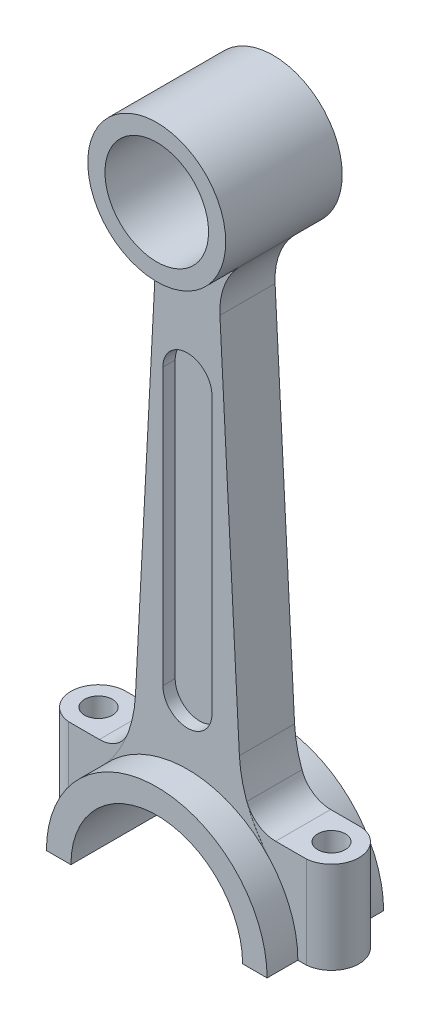
from build123d import *
from build123d.topology import SkipClean

# Parameters (mm, degrees)
SKETCH1_R           = 16.9
BOSS_EXTRUDE1_DEPTH = 9
SKETCH3_R           = 22.5
SKETCH3_R_2         = 16.9
BOSS_EXTRUDE2_DEPTH = 19
SKETCH4_R           = 4.5
BOSS_EXTRUDE3_DEPTH = 30
CUT_EXTRUDE2_DEPTH  = 4
CUT_EXTRUDE3_DEPTH  = 138.13719408
FILLET1_R           = 10
FILLET2_R           = 10
SKETCH7_R           = 4.523289267
SKETCH7_R_2         = 4.5
CUT_EXTRUDE4_DEPTH  = 230.372382819


with BuildPart() as part:
    # Sketch1 → Boss-Extrude1 (new, symmetric)
    with BuildSketch(Plane.XY):
        with BuildLine():
            Line((-10.60459099, 68.908072309), (-16.957576671, -52.314115855))
            ThreePointArc((-16.957576671, -52.314115855), (-19.883826234, -65.373191797), (-26.953938029, -76.736110444))
            ThreePointArc((-26.953938029, -76.736110444), (-33.66260365, -87.839548775), (-36, -100.6))
            Line((-36, -100.6), (-28, -100.6))
            ThreePointArc((-28, -100.6), (0, -72.6), (28, -100.6))
            Line((28, -100.6), (36, -100.6))
            ThreePointArc((36, -100.6), (33.66260365, -87.839548775), (26.953938029, -76.736110444))
            ThreePointArc((26.953938029, -76.736110444), (19.883826234, -65.373191797), (16.957576671, -52.314115855))
            Line((16.957576671, -52.314115855), (10.60459099, 68.908072309))
            ThreePointArc((10.60459099, 68.908072309), (11.910272087, 77.724804636), (16.536877761, 85.342815662))
            ThreePointArc((16.536877761, 85.342815662), (0, 123.1), (-16.536877761, 85.342815662))
            ThreePointArc((-16.536877761, 85.342815662), (-11.910272087, 77.724804636), (-10.60459099, 68.908072309))
        make_face()
        with Locations((0, 100.6)):
            Circle(SKETCH1_R, mode=Mode.SUBTRACT)
    extrude(amount=BOSS_EXTRUDE1_DEPTH, both=True)

    # Sketch3 → Boss-Extrude2 (add, symmetric)
    # profile 1 of 2: a face of its own
    with SkipClean():  # the faces are left unmerged after this step: merging them gives an invalid solid
        with BuildSketch(Plane.XY):
            with Locations((0, 100.6)):
                Circle(SKETCH3_R)
            with Locations((0, 100.6)):
                Circle(SKETCH3_R_2, mode=Mode.SUBTRACT)
        # profile 2 of 2: a face of its own
        with BuildSketch(Plane.XY):
            with BuildLine():
                Line((-28, -100.6), (-36, -100.6))
                ThreePointArc((-36, -100.6), (0, -64.6), (36, -100.6))
                Line((36, -100.6), (28, -100.6))
                ThreePointArc((28, -100.6), (0, -72.6), (-28, -100.6))
            make_face()
        extrude(amount=BOSS_EXTRUDE2_DEPTH, both=True)

    # Sketch4 → Boss-Extrude3 (add)
    with SkipClean():  # the faces are left unmerged after this step: merging them gives an invalid solid
        with BuildSketch(Plane.XZ.offset(100.6)):
            with BuildLine():
                Line((28, 8.968695557), (-28, 8.968695557))
                Line((-28, 8.968695557), (-38.75, 8.968695557))
                ThreePointArc((-38.75, 8.968695557), (-47, 0), (-38.75, -8.968695557))
                Line((-38.75, -8.968695557), (-28, -8.968695557))
                Line((-28, -8.968695557), (28, -8.968695557))
                Line((28, -8.968695557), (38.75, -8.968695557))
                ThreePointArc((38.75, -8.968695557), (47, 0), (38.75, 8.968695557))
                Line((38.75, 8.968695557), (28, 8.968695557))
            make_face()
            with Locations((-38, 0)):
                Circle(SKETCH4_R, mode=Mode.SUBTRACT)
            with Locations((38, 0)):
                Circle(SKETCH4_R, mode=Mode.SUBTRACT)
        extrude(amount=-BOSS_EXTRUDE3_DEPTH)

    # Sketch5 → Cut-Extrude2 (cut)
    with SkipClean():  # the faces are left unmerged after this step: merging them gives an invalid solid
        with BuildSketch(Plane.XY.offset(9)):
            with BuildLine():
                Line((-8, 45), (-8, -45))
                ThreePointArc((-8, -45), (0, -53), (8, -45))
                Line((8, -45), (8, 45))
                ThreePointArc((8, 45), (0, 53), (-8, 45))
            make_face()
        cut_extrude2 = extrude(amount=-CUT_EXTRUDE2_DEPTH, mode=Mode.SUBTRACT)

    # Mirror1: Cut-Extrude2 across plane
    with SkipClean():  # the faces are left unmerged after this step: merging them gives an invalid solid
        add(cut_extrude2.mirror(Plane.XY), mode=Mode.SUBTRACT)

    # Sketch6 → Cut-Extrude3 (cut, through all)
    with SkipClean():  # the faces are left unmerged after this step: merging them gives an invalid solid
        with BuildSketch(Plane.XY.offset(19)):
            with BuildLine():
                Line((28, -100.6), (-28, -100.6))
                ThreePointArc((-28, -100.6), (0, -72.6), (28, -100.6))
            make_face()
        extrude(amount=-CUT_EXTRUDE3_DEPTH, mode=Mode.SUBTRACT)

    # Fillet1
    fillet1_edges = [part.edges().sort_by_distance(p)[0] for p in [
        (22.483530605, -70.6, 0),
    ]]
    fillet(fillet1_edges, radius=FILLET1_R)

    # Fillet2
    fillet2_edges = [part.edges().sort_by_distance(p)[0] for p in [
        (-22.483530605, -70.6, 0),
    ]]
    fillet(fillet2_edges, radius=FILLET2_R)

    # Sketch7 → Cut-Extrude4 (cut, through all)
    with SkipClean():  # the faces are left unmerged after this step: merging them gives an invalid solid
        with BuildSketch(Plane.XZ.offset(100.6)):
            with Locations((-38, 0)):
                Circle(SKETCH7_R)
            with Locations((38, 0)):
                Circle(SKETCH7_R_2)
        extrude(amount=-CUT_EXTRUDE4_DEPTH, mode=Mode.SUBTRACT)
    add(part.part.scale(1), mode=Mode.REPLACE)  # the faces are merged on a copy


solid = part.part
